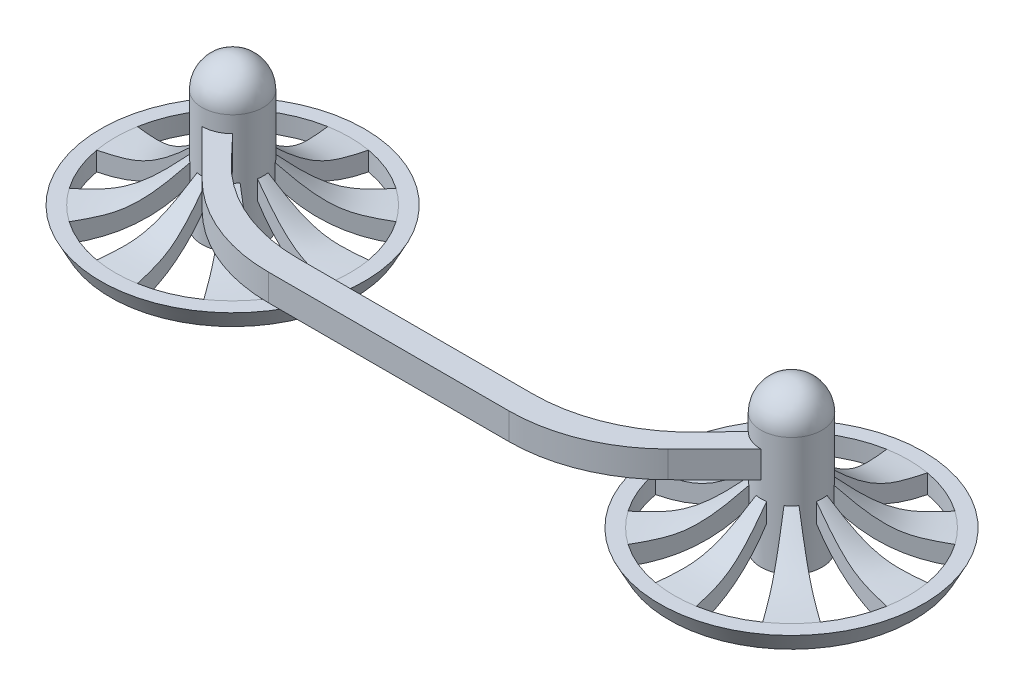
from build123d import *

# Parameters (mm, degrees)
SKETCH1_R                = 5.75
SKETCH1_R_2              = 4.25
BOSS_EXTRUDE1_DEPTH      = 22.3
BOSS_EXTRUDE1_2_DEPTH    = 22.3
REVOLVE7_ANGLE           = 180
REVOLVE8_ANGLE           = 180
SKETCH7_W                = 0.905239948
SKETCH7_H                = 3.550571911
SKETCH7_3_W              = 0.905239948
SKETCH7_3_H              = 3.550571911
REVOLVE11_START          = -1e-07
REVOLVE11_DEPTH          = 11.1500002
REVOLVE11_2_ANGLE        = 20
CIRPATTERN1_COUNT        = 8
MIRROR11_START           = -1e-07
MIRROR11_COPY_1_DEPTH    = 11.1500002
MIRROR11_COPY_2_DEPTH    = 11.1500002
MIRROR11_COPY_3_DEPTH    = 11.1500002
MIRROR11_COPY_4_DEPTH    = 11.1500002
MIRROR11_COPY_5_DEPTH    = 11.1500002
MIRROR11_COPY_6_DEPTH    = 11.1500002
MIRROR11_COPY_7_DEPTH    = 11.1500002
MIRROR11_COPY_8_ANGLE    = 20
MIRROR11_COPY_9_ANGLE    = 20
MIRROR11_COPY_10_ANGLE   = 20
MIRROR11_COPY_11_ANGLE   = 20
MIRROR11_COPY_12_ANGLE   = 20
MIRROR11_COPY_13_ANGLE   = 20
MIRROR11_COPY_14_ANGLE   = 20
BOSS_EXTRUDE2_DEPTH      = 35
BOSS_EXTRUDE2_DEPTH_BACK = 35
SKETCH11_W               = 5
SKETCH11_H               = 5
BOSS_EXTRUDE3_DEPTH      = 5
FILLET1_R                = 30


with BuildPart() as part:
    # Sketch1 → Boss-Extrude1 (new body)
    with BuildSketch(Plane(origin=(0, 0, 0), x_dir=(1, 0, 0), z_dir=(0, 1, 0))):
        with Locations(Location((-52.5, 0, 0), (0, 0, 270))):
            Circle(SKETCH1_R)
        with Locations(Location((-52.5, 0, 0), (0, 0, 270))):
            Circle(SKETCH1_R_2, mode=Mode.SUBTRACT)
    extrude(amount=BOSS_EXTRUDE1_DEPTH)

    # Sketch4 → Revolve7 (revolve)
    with BuildSketch(Plane(origin=(0, 22.3, 0), x_dir=(1, 0, 0), z_dir=(0, 1, 0))):
        with BuildLine():
            ThreePointArc((-56.75, 0), (-52.5, 4.25), (-48.25, 0))
            Line((-48.25, 0), (-46.75, 0))
            ThreePointArc((-46.75, 0), (-52.5, 5.75), (-58.25, 0))
            Line((-58.25, 0), (-56.75, 0))
        make_face()
    revolve(axis=Axis((-58.25, 22.3, 0), (1, 0, 0)), revolution_arc=REVOLVE7_ANGLE)


with BuildPart() as body_2:
    # Sketch1 → Boss-Extrude1 2 (new body)
    with BuildSketch(Plane(origin=(0, 0, 0), x_dir=(1, 0, 0), z_dir=(0, 1, 0))):
        with Locations(Location((52.5, 0, 0), (0, 0, 270))):
            Circle(SKETCH1_R)
        with Locations(Location((52.5, 0, 0), (0, 0, 270))):
            Circle(SKETCH1_R_2, mode=Mode.SUBTRACT)
    extrude(amount=BOSS_EXTRUDE1_2_DEPTH)

    # Sketch5 → Revolve8 (revolve)
    with BuildSketch(Plane(origin=(0, 22.3, 0), x_dir=(1, 0, 0), z_dir=(0, 1, 0))):
        with BuildLine():
            ThreePointArc((46.75, 0), (52.5, -5.75), (58.25, 0))
            Line((58.25, 0), (56.75, 0))
            ThreePointArc((56.75, 0), (52.5, -4.25), (48.25, 0))
            Line((48.25, 0), (46.75, 0))
        make_face()
    revolve(axis=Axis((58.25, 22.3, 0), (-1, 0, 0)), revolution_arc=REVOLVE8_ANGLE)



with BuildPart() as body_3:
    # Sketch7 → Revolve9 (revolve)
    with BuildSketch(Plane.XY, mode=Mode.PRIVATE) as revolve9_sk:
        Polygon((-75.45, 3.550571911), (-77.292128961, 3.550571911), (-75.45, 0), align=None)
        with Locations((-74.997380026, 1.775285956)):
            Rectangle(SKETCH7_W, SKETCH7_H)
    revolve(revolve9_sk.sketch.rotate(Axis((-52.5, 0, 0), (0, 1, 0)), 270), axis=Axis((-52.5, 0, 0), (0, 1, 0)))


with BuildPart() as body_4:
    # Sketch7<3> → Revolve10 (revolve)
    with BuildSketch(Plane.XY, mode=Mode.PRIVATE) as revolve10_sk:
        with Locations((74.997380026, 1.775285956)):
            Rectangle(SKETCH7_3_W, SKETCH7_3_H)
        Polygon((75.45, 3.550571911), (77.292128961, 3.550571911), (75.45, 0), align=None)
    revolve(revolve10_sk.sketch.rotate(Axis((52.5, 0, 0), (0, 1, 0)), 90), axis=Axis((52.5, 0, 0), (0, 1, 0)))


with BuildPart() as body_2_1:
    add(body_2.part)

    add(body_4.part)  # Revolve11 merges body 4
    # Revolve11: read off the stored shape, not the designer's step
    # Revolve11 outline → Revolve11 (add)
    with BuildSketch(Plane(origin=(0, 0, 0), x_dir=(1, 0, 0), z_dir=(0, 1, 0)).offset(REVOLVE11_START)):
        with BuildLine():
            Line((48.67196759, 21.709850613), (51.501522978, 5.66264458))
            ThreePointArc((51.501522978, 5.66264458), (52.5, 5.75), (53.498477022, 5.66264458))
            Line((53.498477022, 5.66264458), (56.32803241, 21.709850613))
            ThreePointArc((56.32803241, 21.709850613), (52.5, 22.044760052), (48.67196759, 21.709850613))
        make_face()
    revolve11 = extrude(amount=REVOLVE11_DEPTH)

    # Revolve11 2 outline → Revolve11 2 (revolve, cut)
    with BuildSketch(Plane(origin=(52.5, 0, 0), x_dir=(0.17364817766694574, 0, -0.9848077530122054), z_dir=(0.9848077530122054, 0, 0.17364817766694574))):
        with BuildLine():
            Line((5.75, -1e-07), (22.044760052, 0))
            add(Edge.make_bspline(
                [(22.044760052, 0), (12.268458666, 0.465978319), (5.75, 7.6)],
                knots=[0, 0, 0, 1, 1, 1], degree=2))
            Line((5.75, 7.6), (5.75, -1e-07))
        make_face()
        with BuildLine():
            add(Edge.make_bspline(
                [(5.75, 11.15), (8.709262473, 8.463627785), (13.440174823, 4.168979505), (19.700405345, 3.719059608), (22.044760052, 3.550571911)],
                knots=[0, 0, 0, 0, 0.625516233, 1, 1, 1, 1], degree=3))
            Line((22.044760052, 3.550571911), (22.044760052, 11.1500001))
            Line((22.044760052, 11.1500001), (5.75, 11.15))
        make_face()
    revolve11_2 = revolve(axis=Axis((52.5, 0, 0), (0, 1, 0)), revolution_arc=REVOLVE11_2_ANGLE, mode=Mode.SUBTRACT)

    # CirPattern1: Revolve11, Revolve11 2 ×8 about axis
    cirpattern1_axis = Axis((52.5, 0, 0), (0, -1, 0))
    add([revolve11.rotate(cirpattern1_axis, i * 360 / CIRPATTERN1_COUNT) for i in range(1, CIRPATTERN1_COUNT)])
    add([revolve11_2.rotate(cirpattern1_axis, i * 360 / CIRPATTERN1_COUNT) for i in range(1, CIRPATTERN1_COUNT)], mode=Mode.SUBTRACT)


with BuildPart() as part_1:
    add(part.part)

    add(body_3.part)  # Mirror11 merges body 3
    # Mirror11: Revolve11, Revolve11 2 across plane
    add(revolve11.mirror(Plane(origin=(0, 0, 0), x_dir=(0, 0, 1), z_dir=(1, 0, 0))))
    add(revolve11_2.mirror(Plane(origin=(0, 0, 0), x_dir=(0, 0, 1), z_dir=(1, 0, 0))), mode=Mode.SUBTRACT)

    # Mirror11 copy 1 sketch → Mirror11 copy 1 (add)
    with BuildSketch(Plane(origin=(-15.376893988, 0, -37.123106012), x_dir=(-0.7071067811865476, 0, 0.7071067811865475), z_dir=(0, 1, 0)).offset(MIRROR11_START)):
        with BuildLine():
            Line((48.67196759, -21.709850613), (51.501522978, -5.66264458))
            ThreePointArc((51.501522978, -5.66264458), (52.5, -5.75), (53.498477022, -5.66264458))
            Line((53.498477022, -5.66264458), (56.32803241, -21.709850613))
            ThreePointArc((56.32803241, -21.709850613), (52.5, -22.044760052), (48.67196759, -21.709850613))
        make_face()
    extrude(amount=MIRROR11_COPY_1_DEPTH)

    # Mirror11 copy 2 sketch → Mirror11 copy 2 (add)
    with BuildSketch(Plane(origin=(-52.5, 0, -52.5), x_dir=(0, 0, 1), z_dir=(0, 1, 0)).offset(MIRROR11_START)):
        with BuildLine():
            Line((48.67196759, -21.709850613), (51.501522978, -5.66264458))
            ThreePointArc((51.501522978, -5.66264458), (52.5, -5.75), (53.498477022, -5.66264458))
            Line((53.498477022, -5.66264458), (56.32803241, -21.709850613))
            ThreePointArc((56.32803241, -21.709850613), (52.5, -22.044760052), (48.67196759, -21.709850613))
        make_face()
    extrude(amount=MIRROR11_COPY_2_DEPTH)

    # Mirror11 copy 3 sketch → Mirror11 copy 3 (add)
    with BuildSketch(Plane(origin=(-89.623106012, 0, -37.123106012), x_dir=(0.7071067811865475, 0, 0.7071067811865476), z_dir=(0, 1, 0)).offset(MIRROR11_START)):
        with BuildLine():
            Line((48.67196759, -21.709850613), (51.501522978, -5.66264458))
            ThreePointArc((51.501522978, -5.66264458), (52.5, -5.75), (53.498477022, -5.66264458))
            Line((53.498477022, -5.66264458), (56.32803241, -21.709850613))
            ThreePointArc((56.32803241, -21.709850613), (52.5, -22.044760052), (48.67196759, -21.709850613))
        make_face()
    extrude(amount=MIRROR11_COPY_3_DEPTH)

    # Mirror11 copy 4 sketch → Mirror11 copy 4 (add)
    with BuildSketch(Plane(origin=(-105, 0, 0), x_dir=(1, 0, 0), z_dir=(0, 1, 0)).offset(MIRROR11_START)):
        with BuildLine():
            Line((48.67196759, -21.709850613), (51.501522978, -5.66264458))
            ThreePointArc((51.501522978, -5.66264458), (52.5, -5.75), (53.498477022, -5.66264458))
            Line((53.498477022, -5.66264458), (56.32803241, -21.709850613))
            ThreePointArc((56.32803241, -21.709850613), (52.5, -22.044760052), (48.67196759, -21.709850613))
        make_face()
    extrude(amount=MIRROR11_COPY_4_DEPTH)

    # Mirror11 copy 5 sketch → Mirror11 copy 5 (add)
    with BuildSketch(Plane(origin=(-89.623106012, 0, 37.123106012), x_dir=(0.7071067811865477, 0, -0.7071067811865475), z_dir=(0, 1, 0)).offset(MIRROR11_START)):
        with BuildLine():
            Line((48.67196759, -21.709850613), (51.501522978, -5.66264458))
            ThreePointArc((51.501522978, -5.66264458), (52.5, -5.75), (53.498477022, -5.66264458))
            Line((53.498477022, -5.66264458), (56.32803241, -21.709850613))
            ThreePointArc((56.32803241, -21.709850613), (52.5, -22.044760052), (48.67196759, -21.709850613))
        make_face()
    extrude(amount=MIRROR11_COPY_5_DEPTH)

    # Mirror11 copy 6 sketch → Mirror11 copy 6 (add)
    with BuildSketch(Plane(origin=(-52.5, 0, 52.5), x_dir=(0, 0, -1), z_dir=(0, 1, 0)).offset(MIRROR11_START)):
        with BuildLine():
            Line((48.67196759, -21.709850613), (51.501522978, -5.66264458))
            ThreePointArc((51.501522978, -5.66264458), (52.5, -5.75), (53.498477022, -5.66264458))
            Line((53.498477022, -5.66264458), (56.32803241, -21.709850613))
            ThreePointArc((56.32803241, -21.709850613), (52.5, -22.044760052), (48.67196759, -21.709850613))
        make_face()
    extrude(amount=MIRROR11_COPY_6_DEPTH)

    # Mirror11 copy 7 sketch → Mirror11 copy 7 (add)
    with BuildSketch(Plane(origin=(-15.376893988, 0, 37.123106012), x_dir=(-0.7071067811865474, 0, -0.7071067811865477), z_dir=(0, 1, 0)).offset(MIRROR11_START)):
        with BuildLine():
            Line((48.67196759, -21.709850613), (51.501522978, -5.66264458))
            ThreePointArc((51.501522978, -5.66264458), (52.5, -5.75), (53.498477022, -5.66264458))
            Line((53.498477022, -5.66264458), (56.32803241, -21.709850613))
            ThreePointArc((56.32803241, -21.709850613), (52.5, -22.044760052), (48.67196759, -21.709850613))
        make_face()
    extrude(amount=MIRROR11_COPY_7_DEPTH)

    # Mirror11 copy 8 sketch → Mirror11 copy 8 (revolve, cut)
    with BuildSketch(Plane(origin=(-52.5, 0, 0), x_dir=(-0.8191520442890007, 0, -0.5735764363510334), z_dir=(-0.5735764363510334, 0, 0.8191520442890007))):
        with BuildLine():
            Line((5.75, 1e-07), (22.044760052, 0))
            add(Edge.make_bspline(
                [(22.044760052, 0), (12.268458666, -0.465978319), (5.75, -7.6)],
                knots=[0, 0, 0, 1, 1, 1], degree=2))
            Line((5.75, -7.6), (5.75, 1e-07))
        make_face()
        with BuildLine():
            add(Edge.make_bspline(
                [(5.75, -11.15), (8.709262473, -8.463627785), (13.440174823, -4.168979505), (19.700405345, -3.719059608), (22.044760052, -3.550571911)],
                knots=[0, 0, 0, 0, 0.625516233, 1, 1, 1, 1], degree=3))
            Line((22.044760052, -3.550571911), (22.044760052, -11.1500001))
            Line((22.044760052, -11.1500001), (5.75, -11.15))
        make_face()
    revolve(axis=Axis((-52.5, 0, 0), (0, -1, 0)), revolution_arc=MIRROR11_COPY_8_ANGLE, mode=Mode.SUBTRACT)

    # Mirror11 copy 9 sketch → Mirror11 copy 9 (revolve, cut)
    with BuildSketch(Plane(origin=(-52.5, 0, 0), x_dir=(-0.9848077530122054, 0, 0.17364817766694568), z_dir=(0.17364817766694568, 0, 0.9848077530122054))):
        with BuildLine():
            Line((5.75, 1e-07), (22.044760052, 0))
            add(Edge.make_bspline(
                [(22.044760052, 0), (12.268458666, -0.465978319), (5.75, -7.6)],
                knots=[0, 0, 0, 1, 1, 1], degree=2))
            Line((5.75, -7.6), (5.75, 1e-07))
        make_face()
        with BuildLine():
            add(Edge.make_bspline(
                [(5.75, -11.15), (8.709262473, -8.463627785), (13.440174823, -4.168979505), (19.700405345, -3.719059608), (22.044760052, -3.550571911)],
                knots=[0, 0, 0, 0, 0.625516233, 1, 1, 1, 1], degree=3))
            Line((22.044760052, -3.550571911), (22.044760052, -11.1500001))
            Line((22.044760052, -11.1500001), (5.75, -11.15))
        make_face()
    revolve(axis=Axis((-52.5, 0, 0), (0, -1, 0)), revolution_arc=MIRROR11_COPY_9_ANGLE, mode=Mode.SUBTRACT)

    # Mirror11 copy 10 sketch → Mirror11 copy 10 (revolve, cut)
    with BuildSketch(Plane(origin=(-52.5, 0, 0), x_dir=(-0.5735764363510334, 0, 0.8191520442890007), z_dir=(0.8191520442890007, 0, 0.5735764363510334))):
        with BuildLine():
            Line((5.75, 1e-07), (22.044760052, 0))
            add(Edge.make_bspline(
                [(22.044760052, 0), (12.268458666, -0.465978319), (5.75, -7.6)],
                knots=[0, 0, 0, 1, 1, 1], degree=2))
            Line((5.75, -7.6), (5.75, 1e-07))
        make_face()
        with BuildLine():
            add(Edge.make_bspline(
                [(5.75, -11.15), (8.709262473, -8.463627785), (13.440174823, -4.168979505), (19.700405345, -3.719059608), (22.044760052, -3.550571911)],
                knots=[0, 0, 0, 0, 0.625516233, 1, 1, 1, 1], degree=3))
            Line((22.044760052, -3.550571911), (22.044760052, -11.1500001))
            Line((22.044760052, -11.1500001), (5.75, -11.15))
        make_face()
    revolve(axis=Axis((-52.5, 0, 0), (0, -1, 0)), revolution_arc=MIRROR11_COPY_10_ANGLE, mode=Mode.SUBTRACT)

    # Mirror11 copy 11 sketch → Mirror11 copy 11 (revolve, cut)
    with BuildSketch(Plane(origin=(-52.5, 0, 0), x_dir=(0.17364817766694562, 0, 0.9848077530122054), z_dir=(0.9848077530122054, 0, -0.17364817766694562))):
        with BuildLine():
            Line((5.75, 1e-07), (22.044760052, 0))
            add(Edge.make_bspline(
                [(22.044760052, 0), (12.268458666, -0.465978319), (5.75, -7.6)],
                knots=[0, 0, 0, 1, 1, 1], degree=2))
            Line((5.75, -7.6), (5.75, 1e-07))
        make_face()
        with BuildLine():
            add(Edge.make_bspline(
                [(5.75, -11.15), (8.709262473, -8.463627785), (13.440174823, -4.168979505), (19.700405345, -3.719059608), (22.044760052, -3.550571911)],
                knots=[0, 0, 0, 0, 0.625516233, 1, 1, 1, 1], degree=3))
            Line((22.044760052, -3.550571911), (22.044760052, -11.1500001))
            Line((22.044760052, -11.1500001), (5.75, -11.15))
        make_face()
    revolve(axis=Axis((-52.5, 0, 0), (0, -1, 0)), revolution_arc=MIRROR11_COPY_11_ANGLE, mode=Mode.SUBTRACT)

    # Mirror11 copy 12 sketch → Mirror11 copy 12 (revolve, cut)
    with BuildSketch(Plane(origin=(-52.5, 0, 0), x_dir=(0.8191520442890008, 0, 0.5735764363510335), z_dir=(0.5735764363510335, 0, -0.8191520442890008))):
        with BuildLine():
            Line((5.75, 1e-07), (22.044760052, 0))
            add(Edge.make_bspline(
                [(22.044760052, 0), (12.268458666, -0.465978319), (5.75, -7.6)],
                knots=[0, 0, 0, 1, 1, 1], degree=2))
            Line((5.75, -7.6), (5.75, 1e-07))
        make_face()
        with BuildLine():
            add(Edge.make_bspline(
                [(5.75, -11.15), (8.709262473, -8.463627785), (13.440174823, -4.168979505), (19.700405345, -3.719059608), (22.044760052, -3.550571911)],
                knots=[0, 0, 0, 0, 0.625516233, 1, 1, 1, 1], degree=3))
            Line((22.044760052, -3.550571911), (22.044760052, -11.1500001))
            Line((22.044760052, -11.1500001), (5.75, -11.15))
        make_face()
    revolve(axis=Axis((-52.5, 0, 0), (0, -1, 0)), revolution_arc=MIRROR11_COPY_12_ANGLE, mode=Mode.SUBTRACT)

    # Mirror11 copy 13 sketch → Mirror11 copy 13 (revolve, cut)
    with BuildSketch(Plane(origin=(-52.5, 0, 0), x_dir=(0.9848077530122054, 0, -0.17364817766694554), z_dir=(-0.17364817766694554, 0, -0.9848077530122054))):
        with BuildLine():
            Line((5.75, 1e-07), (22.044760052, 0))
            add(Edge.make_bspline(
                [(22.044760052, 0), (12.268458666, -0.465978319), (5.75, -7.6)],
                knots=[0, 0, 0, 1, 1, 1], degree=2))
            Line((5.75, -7.6), (5.75, 1e-07))
        make_face()
        with BuildLine():
            add(Edge.make_bspline(
                [(5.75, -11.15), (8.709262473, -8.463627785), (13.440174823, -4.168979505), (19.700405345, -3.719059608), (22.044760052, -3.550571911)],
                knots=[0, 0, 0, 0, 0.625516233, 1, 1, 1, 1], degree=3))
            Line((22.044760052, -3.550571911), (22.044760052, -11.1500001))
            Line((22.044760052, -11.1500001), (5.75, -11.15))
        make_face()
    revolve(axis=Axis((-52.5, 0, 0), (0, -1, 0)), revolution_arc=MIRROR11_COPY_13_ANGLE, mode=Mode.SUBTRACT)

    # Mirror11 copy 14 sketch → Mirror11 copy 14 (revolve, cut)
    with BuildSketch(Plane(origin=(-52.5, 0, 0), x_dir=(0.5735764363510335, 0, -0.8191520442890006), z_dir=(-0.8191520442890006, 0, -0.5735764363510335))):
        with BuildLine():
            Line((5.75, 1e-07), (22.044760052, 0))
            add(Edge.make_bspline(
                [(22.044760052, 0), (12.268458666, -0.465978319), (5.75, -7.6)],
                knots=[0, 0, 0, 1, 1, 1], degree=2))
            Line((5.75, -7.6), (5.75, 1e-07))
        make_face()
        with BuildLine():
            add(Edge.make_bspline(
                [(5.75, -11.15), (8.709262473, -8.463627785), (13.440174823, -4.168979505), (19.700405345, -3.719059608), (22.044760052, -3.550571911)],
                knots=[0, 0, 0, 0, 0.625516233, 1, 1, 1, 1], degree=3))
            Line((22.044760052, -3.550571911), (22.044760052, -11.1500001))
            Line((22.044760052, -11.1500001), (5.75, -11.15))
        make_face()
    revolve(axis=Axis((-52.5, 0, 0), (0, -1, 0)), revolution_arc=MIRROR11_COPY_14_ANGLE, mode=Mode.SUBTRACT)

    add(body_2_1.part)  # Boss-Extrude3 merges body 2


with BuildPart() as body_3_2:
    # Sketch11 → Boss-Extrude2 (new, two sides: drawn at the far end of the back side and taken through both)
    with BuildSketch(Plane(origin=(0, 0, 0), x_dir=(0, 0, -1), z_dir=(1, 0, 0)).offset(-BOSS_EXTRUDE2_DEPTH_BACK)):
        with Locations((-20.70632229, 16.725)):
            Rectangle(SKETCH11_W, SKETCH11_H)
    extrude(amount=BOSS_EXTRUDE2_DEPTH + BOSS_EXTRUDE2_DEPTH_BACK)


with BuildPart() as part_2:
    add(part_1.part)

    add(body_3_2.part)  # Boss-Extrude3 merges body 3 2
    # Sketch13 → Boss-Extrude3 (add)
    with BuildSketch(Plane(origin=(0, 19.225, 0), x_dir=(1, 0, 0), z_dir=(0, 1, 0))):
        Polygon((52.5, -5.75), (35, -23.20632229), (35, -18.20632229), (48.434136008, -4.065863992), align=None)
        Polygon((-35, -18.20632229), (-48.434136008, -4.065863992), (-52.5, -5.75), (-35, -23.20632229), align=None)
    extrude(amount=-BOSS_EXTRUDE3_DEPTH)

    # Fillet1
    fillet1_edges = [part_2.edges().sort_by_distance(p)[0] for p in [
        (35, 16.725, 23.20632229),
        (35, 16.725, 18.20632229),
        (-35, 16.725, 18.20632229),
        (-35, 16.725, 23.20632229),
    ]]
    fillet(fillet1_edges, radius=FILLET1_R)


solid = part_2.part
